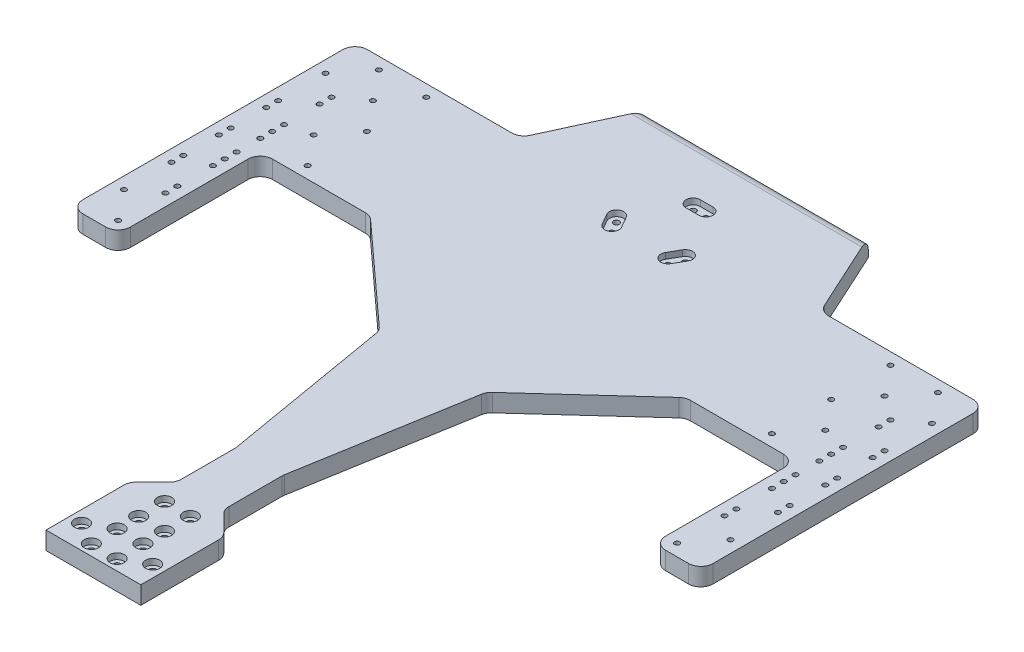
from build123d import *

# Parameters (mm, degrees)
BOSS_EXTRUDE1_DEPTH                = 9.525
SKETCH2_W                          = 50.8
SKETCH2_H                          = 76.2
PERINEUM_SUPPORT_DEPTH             = 9.525
SKETCH3_W                          = 50.8
SKETCH3_H                          = 50.8
RAIL_WHEEL_MOUNT_DEPTH             = 9.525
SKETCH6_W                          = 286.8
SKETCH6_H                          = 76.2
WHEELBASE_DEPTH                    = 9.525
SKETCH4_R                          = 1.575
THRU_HOLE_FT_SENSOR_DEPTH          = 9.525
COUNTERBORE_FT_SENSOR_DEPTH        = 3.175
SKETCH9_R                          = 1.35255
DRIVE_MT_HOLES_DEPTH               = 9.525
SKETCH10_R                         = 1.8288
THRU_HOLES_RAIL_WHEEL_MOUNT_DEPTH  = 9.525
SKETCH11_R                         = 3.81
COUNTERBORE_RAIL_WHEEL_MOUNT_DEPTH = 3.175
SKETCH12_W                         = 328.373883098
SKETCH12_H                         = 304.8
REMOVE_FACE_SUPPORT_DEPTH          = 9525
SKETCH13_W                         = 25.4
SKETCH13_H                         = 152.4
EXTENDED_DRIVE_MOUNT_DEPTH         = 9.525
SKETCH14_R                         = 1.35255
DRIVE_MT_HOLES_1IN_OFF_DEPTH       = 9.525
SKETCH15_R                         = 1.35255
DRIVE_MT_HOLES_2IN_OFF_DEPTH       = 9.525
SKETCH16_R                         = 1.35255
DRIVE_MT_HOLES_3IN_OFF_DEPTH       = 9.525
TRIM_REAR_CHASSIS_DEPTH            = 9.525
TRIM_FORWARD_CHASSIS_DEPTH         = 9.525
TRIM_TAIL_WHEEL_MT_DEPTH           = 9.525
FILLET_CHASSIS_R                   = 6.604
FILLET_FRONT_R                     = 6.35
SKETCH23_R                         = 1.35255
DRIVE_MT_HOLES_0IN_OFF_DEPTH       = 12.7


with BuildPart() as part:
    # Sketch1 → Boss-Extrude1 (new body)
    with BuildSketch(Plane(origin=(0, 0, 0), x_dir=(1, 0, 0), z_dir=(0, 1, 0))):
        Polygon((-1.44417, 328.045), (-2.16449, 328.102), (-2.88266, 328.181), (-3.59799, 328.283), (-4.30977, 328.407), (-5.01729, 328.554), (-5.71986, 328.723), (-6.41679, 328.913), (-7.10738, 329.126), (-7.79097, 329.36), (-8.46686, 329.615), (-9.1344, 329.892), (-9.79292, 330.189), (-10.4418, 330.507), (-11.0803, 330.845), (-11.7079, 331.203), (-12.324, 331.58), (-12.9279, 331.977), (-13.5191, 332.393), (-14.0968, 332.826), (-14.6608, 333.278), (-15.2102, 333.747), (-15.7446, 334.234), (-16.2634, 334.737), (-16.7663, 335.255), (-17.2525, 335.79), (-17.7218, 336.339), (-18.1736, 336.903), (-18.6074, 337.481), (-19.0228, 338.072), (-19.4195, 338.676), (-19.7971, 339.292), (-20.155, 339.92), (-20.4931, 340.558), (-20.811, 341.207), (-21.1084, 341.866), (-21.3849, 342.533), (-21.6402, 343.209), (-21.8743, 343.893), (-22.0867, 344.583), (-22.2774, 345.28), (-22.4461, 345.983), (-22.5926, 346.69), (-22.7168, 347.402), (-22.8186, 348.117), (-22.8979, 348.835), (-22.9546, 349.556), (-22.9886, 350.278), (-23, 351), (-23, 436), (-23.0138, 436.879), (-23.0552, 437.758), (-23.1243, 438.635), (-23.2208, 439.509), (-23.3447, 440.38), (-23.496, 441.247), (-23.6743, 442.108), (-23.8797, 442.963), (-24.1118, 443.812), (-24.3704, 444.652), (-24.6553, 445.485), (-24.9662, 446.307), (-25.3029, 447.12), (-25.6648, 447.922), (-26.0518, 448.712), (-26.4634, 449.489), (-26.8992, 450.253), (-27.3588, 451.003), (-27.8417, 451.738), (-28.3475, 452.458), (-28.8757, 453.161), (-29.4256, 453.848), (-29.9969, 454.517), (-30.5889, 455.167), (-31.201, 455.799), (-31.8327, 456.411), (-32.4833, 457.003), (-33.1521, 457.574), (-33.8386, 458.124), (-34.542, 458.652), (-35.2617, 459.158), (-35.9968, 459.641), (-36.7468, 460.101), (-37.5109, 460.537), (-38.2883, 460.948), (-39.0782, 461.335), (-39.8799, 461.697), (-40.6925, 462.034), (-41.5153, 462.345), (-42.3475, 462.63), (-43.1882, 462.888), (-44.0367, 463.12), (-44.892, 463.326), (-45.7533, 463.504), (-46.6198, 463.655), (-47.4907, 463.779), (-48.365, 463.876), (-49.2419, 463.945), (-50.1205, 463.986), (-51, 464), (-54, 464), (-54.8795, 463.986), (-55.7581, 463.945), (-56.635, 463.876), (-57.5093, 463.779), (-58.3802, 463.655), (-59.2467, 463.504), (-60.108, 463.326), (-60.9633, 463.12), (-61.8117, 462.888), (-62.6525, 462.63), (-63.4846, 462.345), (-64.3075, 462.034), (-65.1201, 461.697), (-65.9218, 461.335), (-66.7117, 460.948), (-67.4891, 460.537), (-68.2532, 460.101), (-69.0031, 459.641), (-69.7383, 459.158), (-70.458, 458.652), (-71.1614, 458.124), (-71.8479, 457.574), (-72.5167, 457.003), (-73.1673, 456.411), (-73.799, 455.799), (-74.4111, 455.167), (-75.0031, 454.517), (-75.5744, 453.848), (-76.1243, 453.161), (-76.6525, 452.458), (-77.1582, 451.738), (-77.6412, 451.003), (-78.1008, 450.253), (-78.5366, 449.489), (-78.9482, 448.712), (-79.3351, 447.922), (-79.6971, 447.12), (-80.0337, 446.307), (-80.3447, 445.485), (-80.6296, 444.652), (-80.8882, 443.812), (-81.1203, 442.963), (-81.3257, 442.108), (-81.504, 441.247), (-81.6553, 440.38), (-81.7792, 439.509), (-81.8757, 438.635), (-81.9447, 437.758), (-81.9862, 436.879), (-82, 436), (-82, 273), (-96, 239), (-114, 205), (-118, 182), (-117, 160), (-113, 147), (-106, 140), (-97, 135), (-76, 120), (-65, 110), (-57, 99), (-54, 93), (-53, 83), (-48, 56), (-38, 29), (-32, 18), (-27, 12), (-19, 7), (-11, 3), (-5, 1), (0, 0), (5, 1), (11, 3), (19, 7), (27, 12), (32, 18), (38, 29), (48, 56), (53, 83), (54, 93), (57, 99), (65, 110), (76, 120), (97, 135), (106, 140), (113, 147), (117, 160), (118, 182), (114, 205), (96, 239), (82, 273), (82, 436), (81.9862, 436.879), (81.9447, 437.758), (81.8757, 438.635), (81.7792, 439.509), (81.6553, 440.38), (81.504, 441.247), (81.3257, 442.108), (81.1203, 442.963), (80.8882, 443.812), (80.6296, 444.652), (80.3447, 445.485), (80.0337, 446.307), (79.6971, 447.12), (79.3351, 447.922), (78.9482, 448.712), (78.5366, 449.489), (78.1008, 450.253), (77.6412, 451.003), (77.1582, 451.738), (76.6525, 452.458), (76.1243, 453.161), (75.5744, 453.848), (75.0031, 454.517), (74.4111, 455.167), (73.799, 455.799), (73.1673, 456.411), (72.5167, 457.003), (71.8479, 457.574), (71.1614, 458.124), (70.458, 458.652), (69.7383, 459.158), (69.0031, 459.641), (68.2532, 460.101), (67.4891, 460.537), (66.7117, 460.948), (65.9218, 461.335), (65.1201, 461.697), (64.3075, 462.034), (63.4846, 462.345), (62.6525, 462.63), (61.8117, 462.888), (60.9633, 463.12), (60.108, 463.326), (59.2467, 463.504), (58.3802, 463.655), (57.5093, 463.779), (56.635, 463.876), (55.7581, 463.945), (54.8795, 463.986), (54, 464), (51, 464), (50.1205, 463.986), (49.2419, 463.945), (48.365, 463.876), (47.4907, 463.779), (46.6198, 463.655), (45.7533, 463.504), (44.892, 463.326), (44.0367, 463.12), (43.1882, 462.888), (42.3475, 462.63), (41.5153, 462.345), (40.6925, 462.034), (39.8799, 461.697), (39.0782, 461.335), (38.2883, 460.948), (37.5109, 460.537), (36.7468, 460.101), (35.9968, 459.641), (35.2617, 459.158), (34.542, 458.652), (33.8386, 458.124), (33.1521, 457.574), (32.4833, 457.003), (31.8327, 456.411), (31.201, 455.799), (30.5889, 455.167), (29.9969, 454.517), (29.4256, 453.848), (28.8757, 453.161), (28.3475, 452.458), (27.8417, 451.738), (27.3588, 451.003), (26.8992, 450.253), (26.4634, 449.489), (26.0518, 448.712), (25.6648, 447.922), (25.3029, 447.12), (24.9662, 446.307), (24.6553, 445.485), (24.3704, 444.652), (24.1118, 443.812), (23.8797, 442.963), (23.6743, 442.108), (23.496, 441.247), (23.3447, 440.38), (23.2208, 439.509), (23.1243, 438.635), (23.0552, 437.758), (23.0138, 436.879), (23, 436), (23, 351), (22.9886, 350.278), (22.9546, 349.556), (22.8979, 348.835), (22.8186, 348.117), (22.7168, 347.402), (22.5926, 346.69), (22.4461, 345.983), (22.2774, 345.28), (22.0867, 344.583), (21.8743, 343.893), (21.6402, 343.209), (21.3849, 342.533), (21.1084, 341.866), (20.811, 341.207), (20.4931, 340.558), (20.155, 339.92), (19.7971, 339.292), (19.4195, 338.676), (19.0228, 338.072), (18.6074, 337.481), (18.1736, 336.903), (17.7218, 336.339), (17.2525, 335.79), (16.7663, 335.255), (16.2634, 334.737), (15.7446, 334.234), (15.2102, 333.747), (14.6608, 333.278), (14.0968, 332.826), (13.5191, 332.393), (12.9279, 331.977), (12.324, 331.58), (11.7079, 331.203), (11.0803, 330.845), (10.4418, 330.507), (9.79292, 330.189), (9.1344, 329.892), (8.46686, 329.615), (7.79097, 329.36), (7.10738, 329.126), (6.41679, 328.913), (5.71986, 328.723), (5.01729, 328.554), (4.30977, 328.407), (3.59799, 328.283), (2.88266, 328.181), (2.16449, 328.102), (1.44417, 328.045), (0.722443, 328.011), (0, 328), (-0.722443, 328.011), align=None)
    extrude(amount=BOSS_EXTRUDE1_DEPTH)

    # Sketch2 → perineum_support (add)
    with BuildSketch(Plane.XZ):
        Rectangle(SKETCH2_W, SKETCH2_H)
    extrude(amount=-PERINEUM_SUPPORT_DEPTH)

    # Sketch3 → rail_wheel_mount (add)
    with BuildSketch(Plane(origin=(0, 9.525, 0), x_dir=(1, 0, 0), z_dir=(0, 1, 0))):
        with Locations((0, -63.5)):
            Rectangle(SKETCH3_W, SKETCH3_H)
    extrude(amount=-RAIL_WHEEL_MOUNT_DEPTH)

    # Sketch6 → wheelbase (add)
    with BuildSketch(Plane(origin=(0, 9.525, 0), x_dir=(1, 0, 0), z_dir=(0, 1, 0))):
        with Locations((0, 182)):
            Rectangle(SKETCH6_W, SKETCH6_H)
    extrude(amount=-WHEELBASE_DEPTH)

    # Sketch4 → thru_hole_FT_sensor (cut)
    with BuildSketch(Plane(origin=(0, 9.525, 0), x_dir=(1, 0, 0), z_dir=(0, 1, 0))):
        with Locations((3.406977246, 235.821928114)):
            Circle(SKETCH4_R)
        with Locations((-3.406977246, 235.821928114)):
            Circle(SKETCH4_R)
        with Locations((18.43676922, 209.789564788)):
            Circle(SKETCH4_R)
        with Locations((15.029791974, 203.888507098)):
            Circle(SKETCH4_R)
        with Locations((-15.029791974, 203.888507098)):
            Circle(SKETCH4_R)
        with Locations((-18.43676922, 209.789564788)):
            Circle(SKETCH4_R)
    extrude(amount=-THRU_HOLE_FT_SENSOR_DEPTH, mode=Mode.SUBTRACT)

    # Sketch8 → counterbore_FT_sensor (cut)
    with BuildSketch(Plane(origin=(0, 9.525, 0), x_dir=(1, 0, 0), z_dir=(0, 1, 0))):
        with BuildLine():
            Line((-3.406977246, 239.631928114), (3.406977246, 239.631928114))
            ThreePointArc((3.406977246, 239.631928114), (7.216977246, 235.821928114), (3.406977246, 232.011928114))
            Line((3.406977246, 232.011928114), (-3.406977246, 232.011928114))
            ThreePointArc((-3.406977246, 232.011928114), (-7.216977246, 235.821928114), (-3.406977246, 239.631928114))
        make_face()
        with BuildLine():
            Line((21.736326008, 207.884564788), (18.329348762, 201.983507098))
            ThreePointArc((18.329348762, 201.983507098), (13.124791974, 200.58895031), (11.730235186, 205.793507098))
            Line((11.730235186, 205.793507098), (15.137212431, 211.694564788))
            ThreePointArc((15.137212431, 211.694564788), (20.34176922, 213.089121576), (21.736326008, 207.884564788))
        make_face()
        with BuildLine():
            Line((-18.329348762, 201.983507098), (-21.736326008, 207.884564788))
            ThreePointArc((-21.736326008, 207.884564788), (-20.34176922, 213.089121576), (-15.137212431, 211.694564788))
            Line((-15.137212431, 211.694564788), (-11.730235186, 205.793507098))
            ThreePointArc((-11.730235186, 205.793507098), (-13.124791974, 200.58895031), (-18.329348762, 201.983507098))
        make_face()
    extrude(amount=-COUNTERBORE_FT_SENSOR_DEPTH, mode=Mode.SUBTRACT)

    # Sketch9 → drive_mt_holes (cut)
    with BuildSketch(Plane.XZ):
        with Locations((-137.05, -166.125)):
            Circle(SKETCH9_R)
        with Locations((-124.35, -150.25)):
            Circle(SKETCH9_R)
        with Locations((-124.35, -182)):
            Circle(SKETCH9_R)
        with Locations((-124.35, -213.75)):
            Circle(SKETCH9_R)
        with Locations((-137.05, -197.875)):
            Circle(SKETCH9_R)
        with Locations((137.05, -197.875)):
            Circle(SKETCH9_R)
        with Locations((124.35, -213.75)):
            Circle(SKETCH9_R)
        with Locations((124.35, -182)):
            Circle(SKETCH9_R)
        with Locations((124.35, -150.25)):
            Circle(SKETCH9_R)
        with Locations((137.05, -166.125)):
            Circle(SKETCH9_R)
    extrude(amount=-DRIVE_MT_HOLES_DEPTH, mode=Mode.SUBTRACT)

    # Sketch10 → thru_holes_rail_wheel_mount (cut)
    with BuildSketch(Plane.XZ):
        with Locations((6.91515, 57.71515)):
            Circle(SKETCH10_R)
        with Locations((6.91515, 43.88485)):
            Circle(SKETCH10_R)
        with Locations((-6.91515, 43.88485)):
            Circle(SKETCH10_R)
        with Locations((-6.91515, 57.71515)):
            Circle(SKETCH10_R)
        with Locations((-6.91515, 83.11515)):
            Circle(SKETCH10_R)
        with Locations((6.91515, 83.11515)):
            Circle(SKETCH10_R)
        with Locations((6.91515, 69.28485)):
            Circle(SKETCH10_R)
        with Locations((-6.91515, 69.28485)):
            Circle(SKETCH10_R)
        with Locations((-19.05, 76.2)):
            Circle(SKETCH10_R)
        with Locations((19.05, 76.2)):
            Circle(SKETCH10_R)
    extrude(amount=-THRU_HOLES_RAIL_WHEEL_MOUNT_DEPTH, mode=Mode.SUBTRACT)

    # Sketch11 → counterbore_rail_wheel_mount (cut)
    with BuildSketch(Plane(origin=(0, 9.525, 0), x_dir=(1, 0, 0), z_dir=(0, 1, 0))):
        with Locations((-6.91515, -43.88485)):
            Circle(SKETCH11_R)
        with Locations((6.91515, -43.88485)):
            Circle(SKETCH11_R)
        with Locations((-19.05, -76.2)):
            Circle(SKETCH11_R)
        with Locations((19.05, -76.2)):
            Circle(SKETCH11_R)
        with Locations((6.91515, -57.71515)):
            Circle(SKETCH11_R)
        with Locations((-6.91515, -57.71515)):
            Circle(SKETCH11_R)
        with Locations((-6.91515, -69.28485)):
            Circle(SKETCH11_R)
        with Locations((-6.91515, -83.11515)):
            Circle(SKETCH11_R)
        with Locations((6.91515, -69.28485)):
            Circle(SKETCH11_R)
        with Locations((6.91515, -83.11515)):
            Circle(SKETCH11_R)
    extrude(amount=-COUNTERBORE_RAIL_WHEEL_MOUNT_DEPTH, mode=Mode.SUBTRACT)

    # Sketch12 → remove_face_support (cut)
    with BuildSketch(Plane(origin=(0, 9.525, 0), x_dir=(1, 0, 0), z_dir=(0, 1, 0))):
        with Locations((7.934821243, 419.7)):
            Rectangle(SKETCH12_W, SKETCH12_H)
    extrude(amount=-REMOVE_FACE_SUPPORT_DEPTH, mode=Mode.SUBTRACT)

    # Sketch13 → extended_drive_mount (add)
    with BuildSketch(Plane.XZ):
        with Locations((156.1, -143.9)):
            Rectangle(SKETCH13_W, SKETCH13_H)
        with Locations((-156.1, -143.9)):
            Rectangle(SKETCH13_W, SKETCH13_H)
    extrude(amount=-EXTENDED_DRIVE_MOUNT_DEPTH)

    # Sketch14 → drive_mt_holes_1in_off (cut)
    with BuildSketch(Plane(origin=(0, 9.525, 0), x_dir=(1, 0, 0), z_dir=(0, 1, 0))):
        with Locations((-162.45, 140.725)):
            Circle(SKETCH14_R)
        with Locations((-149.75, 124.85)):
            Circle(SKETCH14_R)
        with Locations((-149.75, 188.35)):
            Circle(SKETCH14_R)
        with Locations((-162.45, 172.475)):
            Circle(SKETCH14_R)
        with Locations((162.45, 172.475)):
            Circle(SKETCH14_R)
        with Locations((149.75, 188.35)):
            Circle(SKETCH14_R)
        with Locations((149.75, 124.85)):
            Circle(SKETCH14_R)
        with Locations((162.45, 140.725)):
            Circle(SKETCH14_R)
        with Locations((-149.75, 156.6)):
            Circle(SKETCH14_R)
        with Locations((149.75, 156.6)):
            Circle(SKETCH14_R)
    extrude(amount=-DRIVE_MT_HOLES_1IN_OFF_DEPTH, mode=Mode.SUBTRACT)

    # Sketch15 → drive_mt_holes_2in_off (cut)
    with BuildSketch(Plane(origin=(0, 9.525, 0), x_dir=(1, 0, 0), z_dir=(0, 1, 0))):
        with Locations((-162.45, 115.325)):
            Circle(SKETCH15_R)
        with Locations((-149.75, 99.45)):
            Circle(SKETCH15_R)
        with Locations((-149.75, 162.95)):
            Circle(SKETCH15_R)
        with Locations((-162.45, 147.075)):
            Circle(SKETCH15_R)
        with Locations((162.45, 147.075)):
            Circle(SKETCH15_R)
        with Locations((149.75, 162.95)):
            Circle(SKETCH15_R)
        with Locations((149.75, 99.45)):
            Circle(SKETCH15_R)
        with Locations((162.45, 115.325)):
            Circle(SKETCH15_R)
        with Locations((-149.75, 131.2)):
            Circle(SKETCH15_R)
        with Locations((149.75, 131.2)):
            Circle(SKETCH15_R)
    extrude(amount=-DRIVE_MT_HOLES_2IN_OFF_DEPTH, mode=Mode.SUBTRACT)

    # Sketch16 → drive_mt_holes_3in_off (cut)
    with BuildSketch(Plane(origin=(0, 9.525, 0), x_dir=(1, 0, 0), z_dir=(0, 1, 0))):
        with Locations((-162.45, 89.925)):
            Circle(SKETCH16_R)
        with Locations((-149.75, 74.05)):
            Circle(SKETCH16_R)
        with Locations((-149.75, 137.55)):
            Circle(SKETCH16_R)
        with Locations((-162.45, 121.675)):
            Circle(SKETCH16_R)
        with Locations((162.45, 121.675)):
            Circle(SKETCH16_R)
        with Locations((149.75, 137.55)):
            Circle(SKETCH16_R)
        with Locations((149.75, 74.05)):
            Circle(SKETCH16_R)
        with Locations((162.45, 89.925)):
            Circle(SKETCH16_R)
        with Locations((-149.75, 105.8)):
            Circle(SKETCH16_R)
        with Locations((149.75, 105.8)):
            Circle(SKETCH16_R)
    extrude(amount=-DRIVE_MT_HOLES_3IN_OFF_DEPTH, mode=Mode.SUBTRACT)

    # Sketch19 → trim_rear_chassis (cut)
    with BuildSketch(Plane(origin=(0, 9.525, 0), x_dir=(1, 0, 0), z_dir=(0, 1, 0))):
        Polygon((109.9, 143.9), (84.5, 143.9), (28.6, 93), (12.7, 0), (109.9, 0), align=None)
        Polygon((-12.7, 0), (-28.6, 93), (-84.5, 143.9), (-109.9, 143.9), (-109.9, 0), align=None)
    extrude(amount=-TRIM_REAR_CHASSIS_DEPTH, mode=Mode.SUBTRACT)

    # Sketch20 → trim_forward_chassis (cut)
    with BuildSketch(Plane(origin=(0, 9.525, 0), x_dir=(1, 0, 0), z_dir=(0, 1, 0))):
        Polygon((106.005882353, 220.1), (80.605882353, 220.1), (58.947058824, 267.3), (118.350049836, 267.3), (118.350049836, 220.1), align=None)
        Polygon((-118.350049836, 220.1), (-106.005882353, 220.1), (-80.605882353, 220.1), (-58.947058824, 267.3), (-118.350049836, 267.3), align=None)
    extrude(amount=-TRIM_FORWARD_CHASSIS_DEPTH, mode=Mode.SUBTRACT)

    # Sketch21 → trim_tail_wheel_mt (cut)
    with BuildSketch(Plane(origin=(0, 9.525, 0), x_dir=(1, 0, 0), z_dir=(0, 1, 0))):
        Polygon((12.7, 0), (12.7, -31.75), (25.4, -44.45), (25.4, 0), align=None)
        Polygon((-25.4, 0), (-12.7, 0), (-12.7, -31.75), (-25.4, -44.45), align=None)
    extrude(amount=-TRIM_TAIL_WHEEL_MT_DEPTH, mode=Mode.SUBTRACT)

    # fillet_chassis
    fillet_chassis_edges = [part.edges().sort_by_distance(p)[0] for p in [
        (-25.4, 4.7625, 44.45),
        (-12.7, 4.7625, 31.75),
        (-12.7, 4.7625, 0),
        (-28.6, 4.7625, -93),
        (-84.5, 4.7625, -143.9),
        (-143.4, 4.7625, -143.9),
        (-143.4, 4.7625, -67.7),
        (-168.8, 4.7625, -67.7),
        (-168.8, 4.7625, -220.1),
        (-80.605882353, 4.7625, -220.1),
        (80.605882353, 4.7625, -220.1),
        (168.8, 4.7625, -220.1),
        (168.8, 4.7625, -67.7),
        (143.4, 4.7625, -67.7),
        (143.4, 4.7625, -143.9),
        (84.5, 4.7625, -143.9),
        (28.6, 4.7625, -93),
        (12.7, 4.7625, 0),
        (12.7, 4.7625, 31.75),
        (25.4, 4.7625, 44.45),
    ]]
    fillet(fillet_chassis_edges, radius=FILLET_CHASSIS_R)

    # fillet_front
    fillet_front_edges = [part.edges().sort_by_distance(p)[0] for p in [
        (0, 9.525, -267.3),
    ]]
    fillet(fillet_front_edges, radius=FILLET_FRONT_R)

    # Sketch23 → drive_mt_holes_0in_off (cut)
    with BuildSketch(Plane.XZ):
        with Locations((-149.75, -182)):
            Circle(SKETCH23_R)
        with Locations((-162.45, -166.125)):
            Circle(SKETCH23_R)
        with Locations((-149.75, -150.25)):
            Circle(SKETCH23_R)
        with Locations((-149.75, -213.75)):
            Circle(SKETCH23_R)
        with Locations((-162.45, -197.875)):
            Circle(SKETCH23_R)
        with Locations((149.75, -182)):
            Circle(SKETCH23_R)
        with Locations((162.45, -197.875)):
            Circle(SKETCH23_R)
        with Locations((149.75, -213.75)):
            Circle(SKETCH23_R)
        with Locations((162.45, -166.125)):
            Circle(SKETCH23_R)
        with Locations((149.75, -150.25)):
            Circle(SKETCH23_R)
    extrude(amount=-DRIVE_MT_HOLES_0IN_OFF_DEPTH, mode=Mode.SUBTRACT)


solid = part.part
